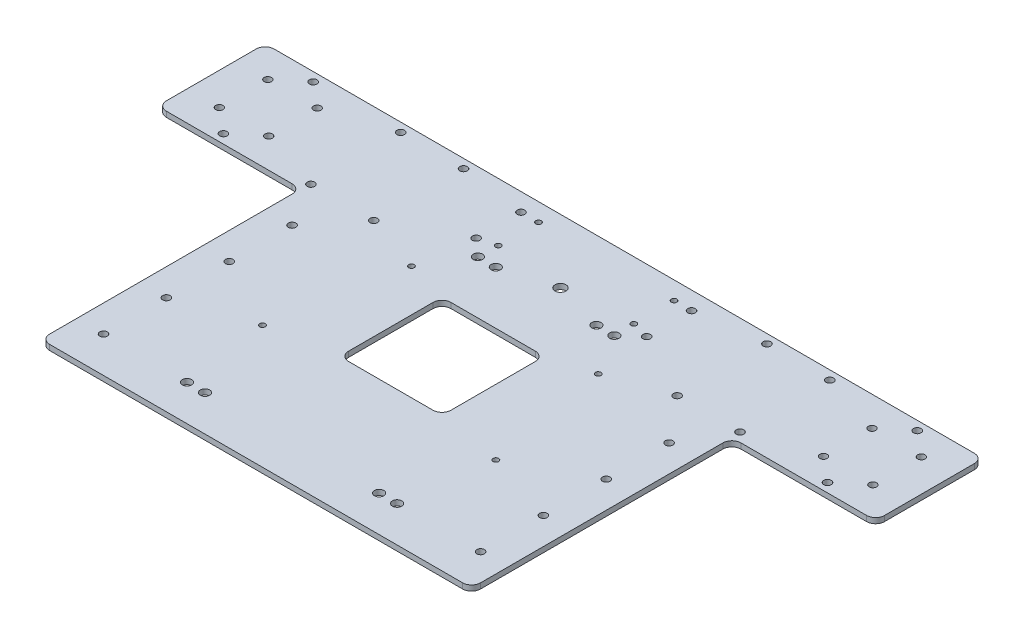
from build123d import *

# Parameters (mm, degrees)
SKETCH_1_R          = 2.1
SKETCH_1_R_2        = 3.05
SKETCH_1_W          = 57
SKETCH_1_H          = 57
EXTRUDE_1377_DEPTH  = 3
SKETCH_2_R          = 2.05
SKETCH_2_R_2        = 2.1
CUT_EXTRUDE_1_DEPTH = 285.15708598
FILLET_1_R          = 5
SKETCH_3_R          = 2.1
SKETCH_3_R_2        = 1.55
SKETCH_3_R_3        = 2.6
CUT_EXTRUDE_2_DEPTH = 285.15708598
SKETCH_4_R          = 1.55
CUT_EXTRUDE_3_DEPTH = 10


with BuildPart() as part:
    # 草图1 → Extrude 1377 (new body)
    with BuildSketch(Plane(origin=(0, 0, 0), x_dir=(1, 0, 0), z_dir=(0, 1, 0))):
        Polygon((-164.424075228, 46.128249268), (-164.424075228, -13.871750732), (-84.424075228, -13.871750732), (-84.424075228, -158.871750732), (155.575924772, -158.871750732), (155.575924772, -13.871750732), (235.575924772, -13.871750732), (235.575924772, 46.128249268), align=None)
        with Locations((-11.924075228, 11.128249268)):
            Circle(SKETCH_1_R, mode=Mode.SUBTRACT)
        with Locations((-11.924075228, 36.128249268)):
            Circle(SKETCH_1_R, mode=Mode.SUBTRACT)
        with Locations((35.575924772, 10.628249268)):
            Circle(SKETCH_1_R_2, mode=Mode.SUBTRACT)
        with Locations((83.075924772, 11.128249268)):
            Circle(SKETCH_1_R, mode=Mode.SUBTRACT)
        with Locations((83.075924772, 36.128249268)):
            Circle(SKETCH_1_R, mode=Mode.SUBTRACT)
        with Locations((35.575924772, -55.371750732)):
            Rectangle(SKETCH_1_W, SKETCH_1_H, mode=Mode.SUBTRACT)
    extrude(amount=EXTRUDE_1377_DEPTH)

    # 草图2 → 切除-拉伸1 (cut, through all)
    with BuildSketch(Plane(origin=(0, 3, 0), x_dir=(1, 0, 0), z_dir=(0, 1, 0))):
        with Locations((-146.424075228, 29.628249268)):
            Circle(SKETCH_2_R)
        with Locations((-146.424075228, 2.628249268)):
            Circle(SKETCH_2_R)
        with Locations((-118.924075228, 29.628249268)):
            Circle(SKETCH_2_R)
        with Locations((-118.924075228, 2.628249268)):
            Circle(SKETCH_2_R)
        with Locations((-48.924075228, 41.128249268)):
            Circle(SKETCH_2_R_2)
        with Locations((-83.924075228, 41.128249268)):
            Circle(SKETCH_2_R_2)
        with Locations((-48.924075228, -8.871750732)):
            Circle(SKETCH_2_R_2)
        with Locations((-83.924075228, -8.871750732)):
            Circle(SKETCH_2_R_2)
        with Locations((-132.674075228, 41.128249268)):
            Circle(SKETCH_2_R_2)
        with Locations((-132.674075228, -8.871750732)):
            Circle(SKETCH_2_R_2)
        with Locations((203.825924772, -8.871750732)):
            Circle(SKETCH_2_R_2)
        with Locations((203.825924772, 41.128249268)):
            Circle(SKETCH_2_R_2)
        with Locations((155.075924772, -8.871750732)):
            Circle(SKETCH_2_R_2)
        with Locations((120.075924772, -8.871750732)):
            Circle(SKETCH_2_R_2)
        with Locations((155.075924772, 41.128249268)):
            Circle(SKETCH_2_R_2)
        with Locations((120.075924772, 41.128249268)):
            Circle(SKETCH_2_R_2)
        with Locations((190.075924772, 2.628249268)):
            Circle(SKETCH_2_R)
        with Locations((190.075924772, 29.628249268)):
            Circle(SKETCH_2_R)
        with Locations((217.575924772, 2.628249268)):
            Circle(SKETCH_2_R)
        with Locations((217.575924772, 29.628249268)):
            Circle(SKETCH_2_R)
    extrude(amount=-CUT_EXTRUDE_1_DEPTH, mode=Mode.SUBTRACT)

    # 圆角1
    fillet_1_edges = [part.edges().sort_by_distance(p)[0] for p in [
        (155.575924772, 1.5, 13.871750732),
        (-84.424075228, 1.5, 13.871750732),
        (235.575924772, 1.5, -46.128249268),
        (235.575924772, 1.5, 13.871750732),
        (155.575924772, 1.5, 158.871750732),
        (-84.424075228, 1.5, 158.871750732),
        (-164.424075228, 1.5, -46.128249268),
        (-164.424075228, 1.5, 13.871750732),
        (7.075924772, 1.5, 83.871750732),
        (64.075924772, 1.5, 83.871750732),
        (64.075924772, 1.5, 26.871750732),
        (7.075924772, 1.5, 26.871750732),
    ]]
    fillet(fillet_1_edges, radius=FILLET_1_R)

    # 草图3 → 切除-拉伸2 (cut, through all)
    with BuildSketch(Plane(origin=(0, 3, 0), x_dir=(1, 0, 0), z_dir=(0, 1, 0))):
        with Locations((-69.424075228, -33.871750732)):
            Circle(SKETCH_3_R)
        with Locations((-69.424075228, -68.871750732)):
            Circle(SKETCH_3_R)
        with Locations((-69.424075228, -103.871750732)):
            Circle(SKETCH_3_R)
        with Locations((-69.424075228, -138.871750732)):
            Circle(SKETCH_3_R)
        with Locations((140.575924772, -138.871750732)):
            Circle(SKETCH_3_R)
        with Locations((140.575924772, -103.871750732)):
            Circle(SKETCH_3_R)
        with Locations((140.575924772, -68.871750732)):
            Circle(SKETCH_3_R)
        with Locations((140.575924772, -33.871750732)):
            Circle(SKETCH_3_R)
        with Locations((-16.424075228, -20.371750732)):
            Circle(SKETCH_3_R_2)
        with Locations((-29.424075228, -90.371750732)):
            Circle(SKETCH_3_R_2)
        with Locations((100.575924772, -90.371750732)):
            Circle(SKETCH_3_R_2)
        with Locations((87.575924772, -20.371750732)):
            Circle(SKETCH_3_R_2)
        with Locations((-2.424075228, 2.628249268)):
            Circle(SKETCH_3_R_3)
        with Locations((7.575924772, 2.628249268)):
            Circle(SKETCH_3_R_3)
        with Locations((63.575924772, 2.628249268)):
            Circle(SKETCH_3_R_3)
        with Locations((73.575924772, 2.628249268)):
            Circle(SKETCH_3_R_3)
        with Locations((-22.924075228, -138.871750732)):
            Circle(SKETCH_3_R_3)
        with Locations((-12.924075228, -138.871750732)):
            Circle(SKETCH_3_R_3)
        with Locations((84.075924772, -138.871750732)):
            Circle(SKETCH_3_R_3)
        with Locations((94.075924772, -138.871750732)):
            Circle(SKETCH_3_R_3)
    extrude(amount=-CUT_EXTRUDE_2_DEPTH, mode=Mode.SUBTRACT)

    # 草图4 → 切除-拉伸3 (cut)
    with BuildSketch(Plane(origin=(0, 3, 0), x_dir=(1, 0, 0), z_dir=(0, 1, 0))):
        with Locations((-2.174075228, 36.128249268)):
            Circle(SKETCH_4_R)
        with Locations((73.325924772, 36.128249268)):
            Circle(SKETCH_4_R)
        with Locations((-2.174075228, 13.728249268)):
            Circle(SKETCH_4_R)
        with Locations((73.325924772, 13.728249268)):
            Circle(SKETCH_4_R)
    extrude(amount=-CUT_EXTRUDE_3_DEPTH, mode=Mode.SUBTRACT)


solid = part.part
